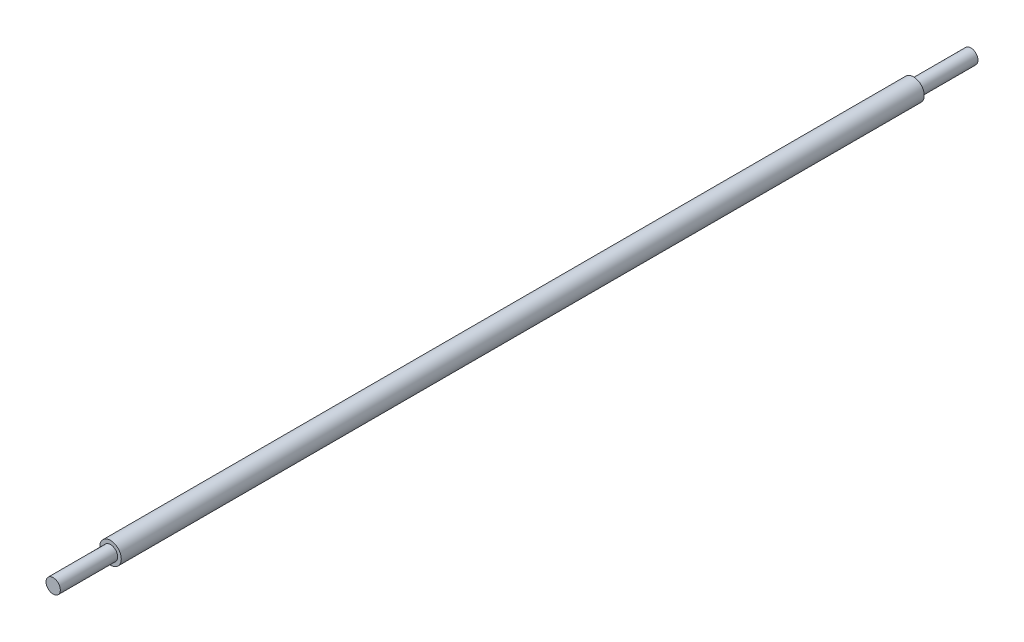
from build123d import *

# Parameters (mm, degrees)
SKETCH1_R           = 2.38125
BOSS_EXTRUDE1_DEPTH = 203.2
SKETCH2_R           = 2.38125
SKETCH2_R_2         = 1.5875
CUT_EXTRUDE1_DEPTH  = 12.7
CUT_EXTRUDE2_START  = -12.7
SKETCH3_R           = 2.38125
SKETCH3_R_2         = 1.5875
CUT_EXTRUDE2_DEPTH  = 12.7


with BuildPart() as part:
    # Sketch1 → Boss-Extrude1 (new body)
    with BuildSketch(Plane.XY):
        Circle(SKETCH1_R)
    extrude(amount=BOSS_EXTRUDE1_DEPTH)

    # Sketch2 → Cut-Extrude1 (cut)
    with BuildSketch(Plane(origin=(0, 0, 0), x_dir=(-1, 0, 0), z_dir=(0, 0, -1))):
        Circle(SKETCH2_R)
        Circle(SKETCH2_R_2, mode=Mode.SUBTRACT)
    extrude(amount=-CUT_EXTRUDE1_DEPTH, mode=Mode.SUBTRACT)

    # Sketch3 → Cut-Extrude2 (cut)
    with BuildSketch(Plane.XY.offset(203.2).offset(CUT_EXTRUDE2_START)):
        Circle(SKETCH3_R)
        Circle(SKETCH3_R_2, mode=Mode.SUBTRACT)
    extrude(amount=CUT_EXTRUDE2_DEPTH, mode=Mode.SUBTRACT)


solid = part.part
